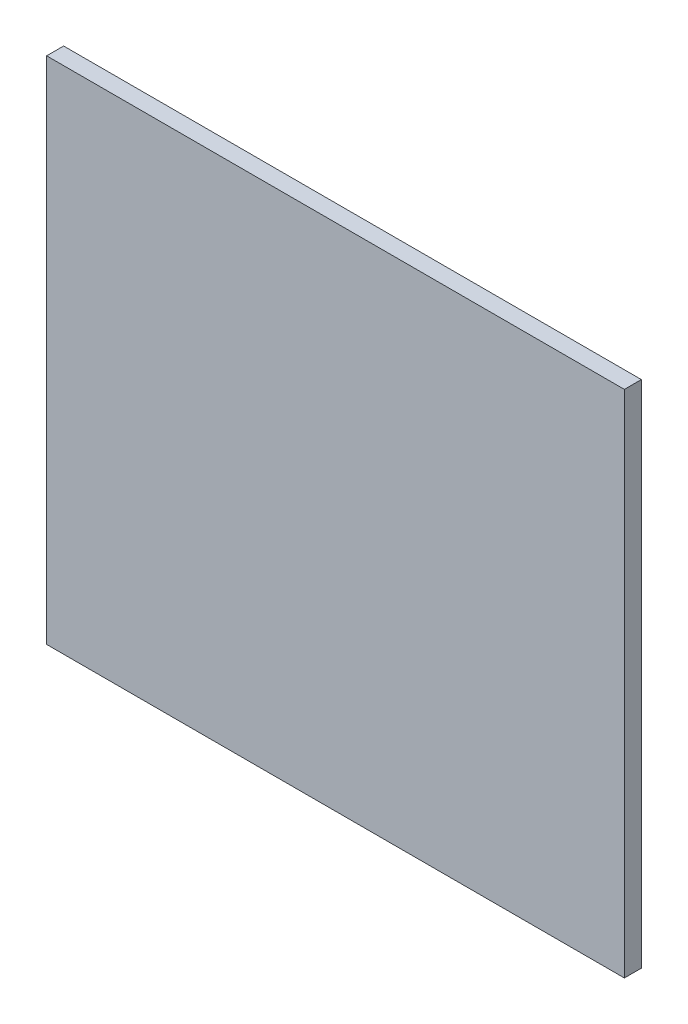
from build123d import *

# Parameters (mm, degrees)
SKETCH1_W           = 340
SKETCH1_H           = 300
BOSS_EXTRUDE1_DEPTH = 10


with BuildPart() as part:
    # Sketch1 → Boss-Extrude1 (new body)
    with BuildSketch(Plane.XY):
        Rectangle(SKETCH1_W, SKETCH1_H)
    extrude(amount=BOSS_EXTRUDE1_DEPTH)


solid = part.part
